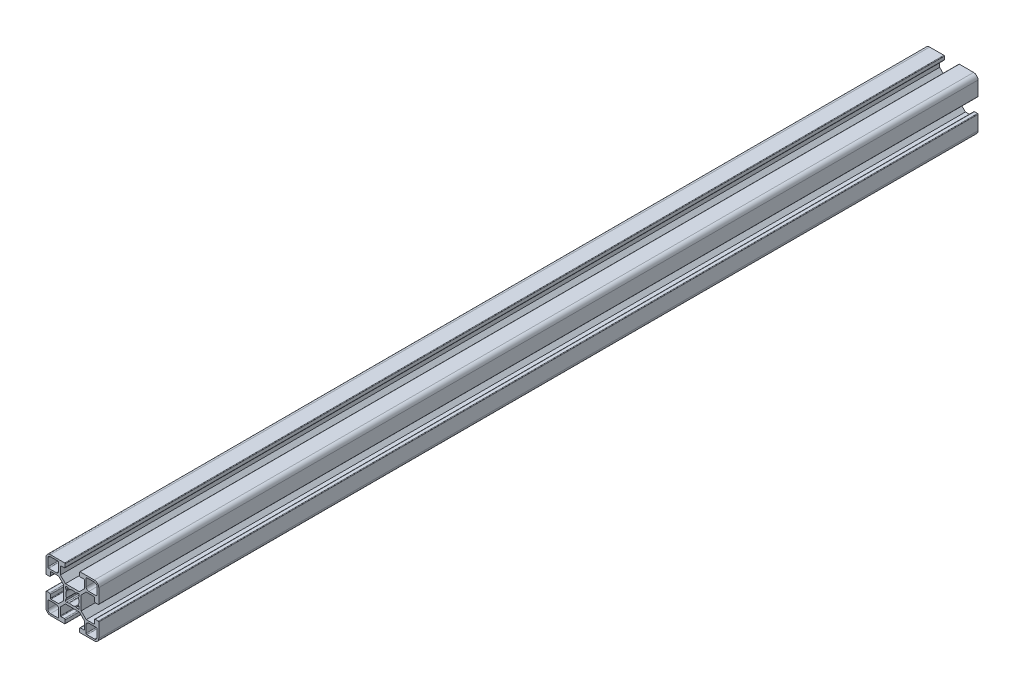
from build123d import *

# Parameters (mm, degrees)
BOSS_EXTRUDE1_DEPTH = 250


with BuildPart() as part:
    # Sketch1 → Boss-Extrude1 (new, symmetric)
    with BuildSketch(Plane.XY):
        with BuildLine():
            Line((21.799990977, 7.139350412), (18.939335294, 10.000004729))
            Line((18.939335294, 10.000004729), (11.060654294, 10.000000095))
            Line((11.060654294, 10.000000095), (8.200000977, 7.139342412))
            Line((8.200000977, 7.139342412), (8.200003529, 2.800001412))
            ThreePointArc((8.200003529, 2.800001412), (8.28786862, 2.587867672), (8.500000706, 2.499998588))
            Line((8.500000706, 2.499998588), (10.400000706, 2.499999706))
            ThreePointArc((10.400000706, 2.499999706), (10.753554287, 2.353553201), (10.900001, 1.999999706))
            Line((10.900001, 1.999999706), (10.900001, 0.299996823))
            ThreePointArc((10.900001, 0.299996823), (10.812134558, 0.087867732), (10.600006, 0))
            Line((10.600006, 0), (2.5, 0))
            ThreePointArc((2.5, 0), (0.732233047, 0.732233047), (0, 2.5))
            Line((0, 2.5), (0, 10.600006))
            ThreePointArc((0, 10.600006), (0.087869562, 10.812137388), (0.300003, 10.900002))
            Line((0.300003, 10.900002), (2, 10.900002))
            ThreePointArc((2, 10.900002), (2.353553391, 10.753555391), (2.5, 10.400002))
            Line((2.5, 10.400002), (2.5, 8.500002))
            ThreePointArc((2.5, 8.500002), (2.587869099, 8.287870075), (2.80000269, 8.200005))
            Line((2.80000269, 8.200005), (7.139344, 8.200005))
            Line((7.139344, 8.200005), (10, 11.06066))
            Line((10, 11.06066), (10, 18.939341))
            Line((10, 18.939341), (7.139344, 21.799995))
            Line((7.139344, 21.799995), (2.800003, 21.799995))
            ThreePointArc((2.800003, 21.799995), (2.587869208, 21.712130034), (2.5, 21.499998))
            Line((2.5, 21.499998), (2.5, 19.59999775))
            ThreePointArc((2.5, 19.59999775), (2.353553161, 19.246444027), (1.999999309, 19.0999975))
            Line((1.999999309, 19.0999975), (0.299996735, 19.099999))
            ThreePointArc((0.299996735, 19.099999), (0.087867778, 19.187865661), (2.65e-07, 19.399994265))
            Line((2.65e-07, 19.399994265), (7.412e-06, 27.500000265))
            ThreePointArc((7.412e-06, 27.500000265), (0.732242019, 29.267766572), (2.500009618, 29.999998059))
            Line((2.500009618, 29.999998059), (10.600015553, 29.999990912))
            ThreePointArc((10.600015553, 29.999990912), (10.812136906, 29.912120832), (10.900001, 29.699997))
            Line((10.900001, 29.699997), (10.900001, 28))
            ThreePointArc((10.900001, 28), (10.75355439, 27.646446609), (10.400001, 27.5))
            Line((10.400001, 27.5), (8.499999, 27.5))
            ThreePointArc((8.499999, 27.5), (8.287868368, 27.412130194), (8.200004, 27.19999731))
            Line((8.200004, 27.19999731), (8.200004, 22.860655))
            Line((8.200004, 22.860655), (11.060659, 20))
            Line((11.060659, 20), (18.93934, 20))
            Line((18.93934, 20), (21.799994, 22.860655))
            Line((21.799994, 22.860655), (21.799994, 27.199997))
            ThreePointArc((21.799994, 27.199997), (21.712129034, 27.412130792), (21.499997, 27.5))
            Line((21.499997, 27.5), (19.599981706, 27.5))
            ThreePointArc((19.599981706, 27.5), (19.246428419, 27.646446505), (19.099981706, 27.999999706))
            Line((19.099981706, 27.999999706), (19.099980706, 29.700007823))
            ThreePointArc((19.099980706, 29.700007823), (19.187847107, 29.912137435), (19.399976029, 30.0000055))
            Line((19.399976029, 30.0000055), (27.499982029, 30.000010265))
            ThreePointArc((27.499982029, 30.000010265), (29.267773762, 29.267782877), (30.000019618, 27.499998794))
            Line((30.000019618, 27.499998794), (30.000022, 19.399992859))
            ThreePointArc((30.000022, 19.399992859), (29.912152899, 19.187838129), (29.6999965, 19.099973058))
            Line((29.6999965, 19.099973058), (27.9999995, 19.099974558))
            ThreePointArc((27.9999995, 19.099974558), (27.646437821, 19.246429455), (27.4999995, 19.599998))
            Line((27.4999995, 19.599998), (27.4999995, 21.5))
            ThreePointArc((27.4999995, 21.5), (27.412129694, 21.712130632), (27.19999681, 21.799995))
            Line((27.19999681, 21.799995), (22.8606545, 21.799995))
            Line((22.8606545, 21.799995), (19.9999995, 18.939341))
            Line((19.9999995, 18.939341), (19.9999995, 11.06066))
            Line((19.9999995, 11.06066), (22.8606545, 8.200005))
            Line((22.8606545, 8.200005), (27.1999965, 8.200005))
            ThreePointArc((27.1999965, 8.200005), (27.412129603, 8.287869277), (27.4999995, 8.500000051))
            Line((27.4999995, 8.500000051), (27.4999995, 10.400002))
            ThreePointArc((27.4999995, 10.400002), (27.646446109, 10.753555391), (27.9999995, 10.900002))
            Line((27.9999995, 10.900002), (29.7000025, 10.900002))
            ThreePointArc((29.7000025, 10.900002), (29.912124124, 10.812131262), (29.999987853, 10.600006735))
            Line((29.999987853, 10.600006735), (29.999990235, 2.500000735))
            ThreePointArc((29.999990235, 2.500000735), (29.267760371, 0.732240274), (27.500000177, 9.765e-06))
            Line((27.500000177, 9.765e-06), (19.399994245, 5e-06))
            ThreePointArc((19.399994245, 5e-06), (19.187862761, 0.087874413), (19.099998, 0.300007824))
            Line((19.099998, 0.300007824), (19.099997, 2.000004824))
            ThreePointArc((19.099997, 2.000004824), (19.246443401, 2.3535583), (19.599996706, 2.500005118))
            Line((19.599996706, 2.500005118), (21.499998706, 2.500006235))
            ThreePointArc((21.499998706, 2.500006235), (21.712129286, 2.587876166), (21.799993529, 2.800009102))
            Line((21.799993529, 2.800009102), (21.799990977, 7.139350412))
        make_face()
        with BuildLine():
            Line((18.878868942, 11.714100014), (18.657285002, 12.75690673))
            Line((18.657285002, 12.75690673), (18.419345869, 12.994846743))
            ThreePointArc((18.419345869, 12.994846743), (18.335473622, 13.158180995), (18.362480424, 13.339793948))
            ThreePointArc((18.362480424, 13.339793948), (18.750006156, 14.99998656), (18.362487962, 16.660180933))
            ThreePointArc((18.362487962, 16.660180933), (18.335481889, 16.841794157), (18.419354758, 17.005128271))
            Line((18.419354758, 17.005128271), (18.657294593, 17.243067582))
            Line((18.657294593, 17.243067582), (18.878893628, 18.28587109))
            ThreePointArc((18.878893628, 18.28587109), (18.743367928, 18.743355263), (18.285883756, 18.878880962))
            Line((18.285883756, 18.878880962), (17.243080247, 18.657281928))
            Line((17.243080247, 18.657281928), (17.005140412, 18.419342617))
            ThreePointArc((17.005140412, 18.419342617), (16.84180664, 18.335470316), (16.660194009, 18.362476539))
            ThreePointArc((16.660194009, 18.362476539), (15.00000526, 18.749996344), (13.339816433, 18.362476869))
            ThreePointArc((13.339816433, 18.362476869), (13.158203164, 18.335470716), (12.994869031, 18.419343671))
            Line((12.994869031, 18.419343671), (12.756929898, 18.657283684))
            Line((12.756929898, 18.657283684), (11.714126233, 18.878881984))
            ThreePointArc((11.714126233, 18.878881984), (11.256641967, 18.743355772), (11.121116891, 18.28587117))
            Line((11.121116891, 18.28587117), (11.342717777, 17.243068055))
            Line((11.342717777, 17.243068055), (11.580656587, 17.00512772))
            ThreePointArc((11.580656587, 17.00512772), (11.664528478, 16.841794182), (11.637522309, 16.660181943))
            ThreePointArc((11.637522309, 16.660181943), (11.250003617, 14.999998075), (11.637519652, 13.339813587))
            ThreePointArc((11.637519652, 13.339813587), (11.664525497, 13.15820068), (11.580652734, 12.994866901))
            Line((11.580652734, 12.994866901), (11.342712898, 12.75692759))
            Line((11.342712898, 12.75692759), (11.12111194, 11.71412449))
            ThreePointArc((11.12111194, 11.71412449), (11.256636795, 11.256640068), (11.714120718, 11.121113524))
            Line((11.714120718, 11.121113524), (12.756924635, 11.342710635))
            Line((12.756924635, 11.342710635), (12.99486447, 11.580649946))
            ThreePointArc((12.99486447, 11.580649946), (13.158198441, 11.66452228), (13.339811235, 11.637515845))
            ThreePointArc((13.339811235, 11.637515845), (14.999988879, 11.249993804), (16.660169832, 11.637501672))
            ThreePointArc((16.660169832, 11.637501672), (16.841782614, 11.664506717), (17.005115943, 11.580633605))
            Line((17.005115943, 11.580633605), (17.243054753, 11.34269327))
            Line((17.243054753, 11.34269327), (18.285858839, 11.12109695))
            ThreePointArc((18.285858839, 11.12109695), (18.743339639, 11.256620822), (18.878868942, 11.714100014))
        make_face(mode=Mode.SUBTRACT)
        with BuildLine():
            Line((23.299995, 1), (27.5, 1))
            ThreePointArc((27.5, 1), (28.560660172, 1.439339828), (29, 2.5))
            Line((29, 2.5), (29, 6.700005))
            ThreePointArc((29, 6.700005), (28.853553391, 7.053558391), (28.5, 7.200005))
            Line((28.5, 7.200005), (24.299995, 7.200005))
            ThreePointArc((24.299995, 7.200005), (23.239334828, 6.760665172), (22.799995, 5.700005))
            Line((22.799995, 5.700005), (22.799995, 1.5))
            ThreePointArc((22.799995, 1.5), (22.946441609, 1.146446609), (23.299995, 1))
        make_face(mode=Mode.SUBTRACT)
        with BuildLine():
            Line((2.5, 1), (6.700005, 1))
            ThreePointArc((6.700005, 1), (7.05355839, 1.146446609), (7.200005, 1.5))
            Line((7.200005, 1.5), (7.200005, 5.700005))
            ThreePointArc((7.200005, 5.700005), (6.760665172, 6.760665172), (5.700005, 7.200005))
            Line((5.700005, 7.200005), (1.5, 7.200005))
            ThreePointArc((1.5, 7.200005), (1.146446609, 7.053558391), (1, 6.700005))
            Line((1, 6.700005), (1, 2.5))
            ThreePointArc((1, 2.5), (1.439339828, 1.439339828), (2.5, 1))
        make_face(mode=Mode.SUBTRACT)
        with BuildLine():
            Line((1.500007412, 22.799993059), (5.700005, 22.799993059))
            ThreePointArc((5.700005, 22.799993059), (6.760665172, 23.239332887), (7.200005, 24.299993059))
            Line((7.200005, 24.299993059), (7.200005, 28.499998059))
            ThreePointArc((7.200005, 28.499998059), (7.053561011, 28.853548829), (6.700012412, 28.999998059))
            Line((6.700012412, 28.999998059), (2.500007412, 28.999998059))
            ThreePointArc((2.500007412, 28.999998059), (1.43934724, 28.560658231), (1.000007412, 27.499998059))
            Line((1.000007412, 27.499998059), (1.000007412, 23.299993059))
            ThreePointArc((1.000007412, 23.299993059), (1.146454021, 22.946439668), (1.500007412, 22.799993059))
        make_face(mode=Mode.SUBTRACT)
        with BuildLine():
            Line((24.300002412, 22.799993059), (28.500007412, 22.799993059))
            ThreePointArc((28.500007412, 22.799993059), (28.853560803, 22.946439668), (29.000007412, 23.299993059))
            Line((29.000007412, 23.299993059), (29.000007412, 27.499998059))
            ThreePointArc((29.000007412, 27.499998059), (28.560667584, 28.560658231), (27.500007412, 28.999998059))
            Line((27.500007412, 28.999998059), (23.300002412, 28.999998059))
            ThreePointArc((23.300002412, 28.999998059), (22.946449021, 28.853551449), (22.800002412, 28.499998059))
            Line((22.800002412, 28.499998059), (22.800002412, 24.299993059))
            ThreePointArc((22.800002412, 24.299993059), (23.23934224, 23.239332887), (24.300002412, 22.799993059))
        make_face(mode=Mode.SUBTRACT)
    extrude(amount=BOSS_EXTRUDE1_DEPTH, both=True)


solid = part.part
